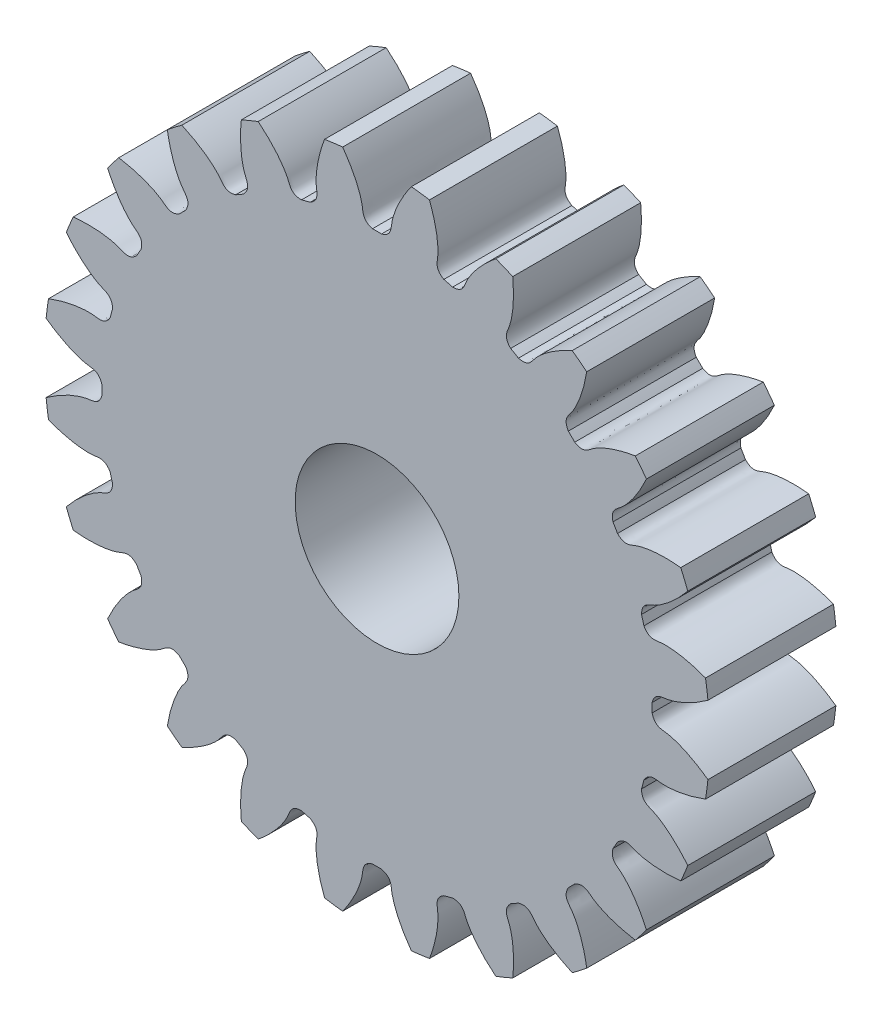
from build123d import *

# Parameters (mm, degrees)
SKETCH_1_R               = 6.5
EXTRUDE_1_DEPTH          = 2.5
CUT_EXTRUDE_1_DEPTH      = 10.526279442
PATTERN_CIRCULAR_1_COUNT = 24
SKETCH_4_R               = 1.6
CUT_EXTRUDE_2_DEPTH      = 5


with BuildPart() as part:
    # 草图1 → 凸台-拉伸1 (new body)
    with BuildSketch(Plane.XY):
        Circle(SKETCH_1_R)
    extrude(amount=EXTRUDE_1_DEPTH)

    # 草图2 → 切除-拉伸1 (cut, through all)
    with BuildSketch(Plane.XY):
        with BuildLine():
            ThreePointArc((0.088415956, 5.374272753), (0, 5.375), (-0.088415956, 5.374272753))
            add(Edge.make_bspline(
                [(-0.088415956, 5.374272753), (-0.283956108, 5.428430036), (-0.269523883, 5.557861799), (-0.293138588, 5.686342226), (-0.296517959, 5.702916521), (-0.300724242, 5.721620073), (-0.305840304, 5.742426358), (-0.311952817, 5.765305336), (-0.319146149, 5.790224685), (-0.327504211, 5.817149434), (-0.337109789, 5.846042111), (-0.348044663, 5.876862729), (-0.360389484, 5.909568827), (-0.374223721, 5.944115495), (-0.389625595, 5.980455405), (-0.406672011, 6.018538843), (-0.425438499, 6.058313744), (-0.445999145, 6.099725726), (-0.468426535, 6.142718129), (-0.492791687, 6.187232054), (-0.519163995, 6.233206399), (-0.547611171, 6.280577906), (-0.57819918, 6.329281201), (-0.610992189, 6.379248841), (-0.64605251, 6.430411359), (-0.68344054, 6.482697309), (-0.723214712, 6.53603332), (-0.765431443, 6.590344144), (-0.810145078, 6.645552705), (-0.857407842, 6.701580158), (-0.907269792, 6.758345935), (-0.959778768, 6.81576781), (-1.014980347, 6.873761948), (-1.0729178, 6.932242967), (-1.133632047, 6.991123994), (-1.197161611, 7.05031673), (-1.263542589, 7.109731505), (-1.332808587, 7.169277345), (-1.430211047, 7.249680778), (-1.505961903, 7.308439159), (-1.55780976, 7.347058965)],
                knots=[0, 0, 0, 0, 0.143961355, 0.149818462, 0.156576662, 0.164235955, 0.172796342, 0.182257821, 0.192620395, 0.203884061, 0.216048821, 0.229114674, 0.24308162, 0.25794966, 0.273718793, 0.290389019, 0.307960339, 0.326432751, 0.345806258, 0.366080857, 0.38725655, 0.409333336, 0.432311215, 0.456190188, 0.480970254, 0.506651413, 0.533233666, 0.560717012, 0.589101451, 0.618386984, 0.64857361, 0.679661329, 0.711650141, 0.744540047, 0.778331046, 0.813023138, 0.848616324, 0.885110603, 0.922505975, 1, 1, 1, 1], degree=3))
            ThreePointArc((-1.55780976, 7.347058965), (0, 7.510395907), (1.55780976, 7.347058965))
            add(Edge.make_bspline(
                [(0.088415956, 5.374272753), (0.283956108, 5.428430036), (0.269523883, 5.557861799), (0.293138588, 5.686342226), (0.296517959, 5.702916521), (0.300724242, 5.721620073), (0.305840304, 5.742426358), (0.311952817, 5.765305336), (0.319146149, 5.790224685), (0.327504211, 5.817149434), (0.337109789, 5.846042111), (0.348044663, 5.876862729), (0.360389484, 5.909568827), (0.374223721, 5.944115495), (0.389625595, 5.980455405), (0.406672011, 6.018538843), (0.425438499, 6.058313744), (0.445999145, 6.099725726), (0.468426535, 6.142718129), (0.492791687, 6.187232054), (0.519163995, 6.233206399), (0.547611171, 6.280577906), (0.57819918, 6.329281201), (0.610992189, 6.379248841), (0.64605251, 6.430411359), (0.68344054, 6.482697309), (0.723214712, 6.53603332), (0.765431443, 6.590344144), (0.810145078, 6.645552705), (0.857407842, 6.701580158), (0.907269792, 6.758345935), (0.959778768, 6.81576781), (1.014980347, 6.873761948), (1.0729178, 6.932242967), (1.133632047, 6.991123994), (1.197161611, 7.05031673), (1.263542589, 7.109731505), (1.332808587, 7.169277345), (1.430211047, 7.249680778), (1.505961903, 7.308439159), (1.55780976, 7.347058965)],
                knots=[0, 0, 0, 0, 0.143961355, 0.149818462, 0.156576662, 0.164235955, 0.172796342, 0.182257821, 0.192620395, 0.203884061, 0.216048821, 0.229114674, 0.24308162, 0.25794966, 0.273718793, 0.290389019, 0.307960339, 0.326432751, 0.345806258, 0.366080857, 0.38725655, 0.409333336, 0.432311215, 0.456190188, 0.480970254, 0.506651413, 0.533233666, 0.560717012, 0.589101451, 0.618386984, 0.64857361, 0.679661329, 0.711650141, 0.744540047, 0.778331046, 0.813023138, 0.848616324, 0.885110603, 0.922505975, 1, 1, 1, 1], degree=3))
        make_face()
    cut_extrude_1 = extrude(amount=CUT_EXTRUDE_1_DEPTH, mode=Mode.SUBTRACT)

    # 阵列(圆周)1: 切除-拉伸1 ×24 about axis
    pattern_circular_1_axis = Axis((0, 0, 2.5), (0, 0, -1))
    for i in range(1, PATTERN_CIRCULAR_1_COUNT):
        add(cut_extrude_1.rotate(pattern_circular_1_axis, i * 360 / PATTERN_CIRCULAR_1_COUNT), mode=Mode.SUBTRACT)

    # 草图4 → 切除-拉伸2 (cut, symmetric)
    with BuildSketch(Plane.XY.offset(2.5)):
        Circle(SKETCH_4_R)
    extrude(amount=CUT_EXTRUDE_2_DEPTH, both=True, mode=Mode.SUBTRACT)


solid = part.part
